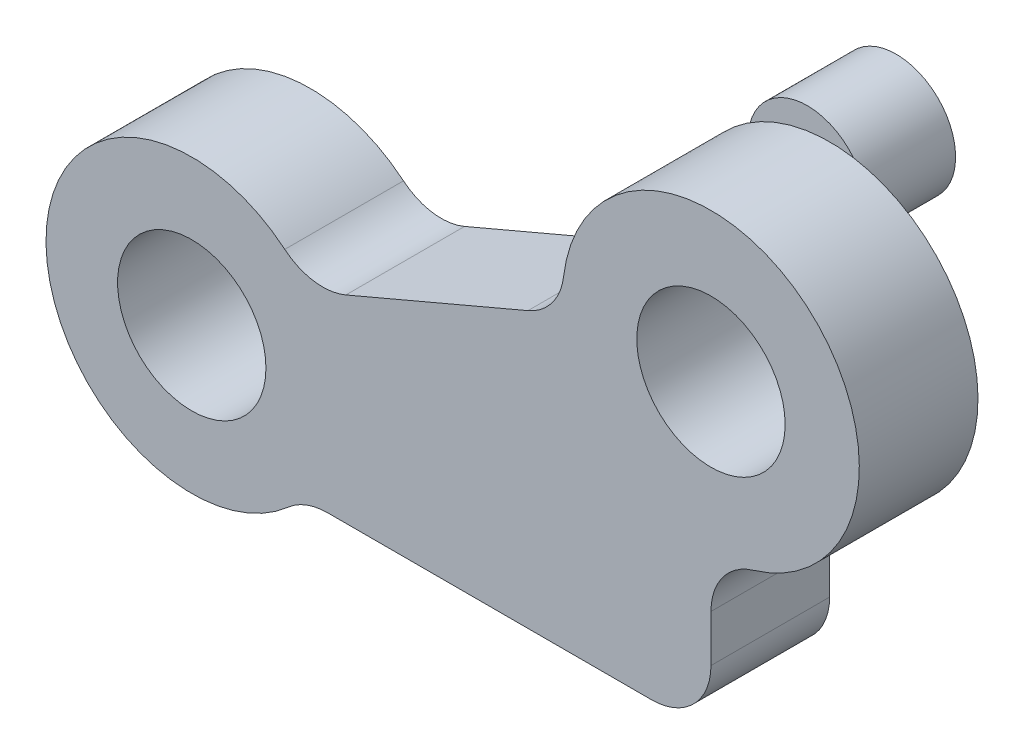
from build123d import *

# Parameters (mm, degrees)
SKETCH1_R           = 2.5
BOSS_EXTRUDE1_DEPTH = 4
FILLET1_R           = 2
BOSS_EXTRUDE2_START = -3.9
SKETCH2_R           = 1
BOSS_EXTRUDE2_DEPTH = 10
SKETCH3_R           = 2
BOSS_EXTRUDE3_DEPTH = 3


with BuildPart() as part:
    # Sketch1 → Boss-Extrude1 (new body)
    with BuildSketch(Plane.XY):
        with BuildLine():
            Line((56.839071038, 28.579919803), (56.839071038, 23.292312115))
            Line((56.839071038, 23.292312115), (43.08257304, 23.292312115))
            ThreePointArc((43.08257304, 23.292312115), (34.429928081, 26.628647856), (43.273147001, 29.420937259))
            Line((43.273147001, 29.420937259), (51.8645252, 33.076041142))
            ThreePointArc((51.8645252, 33.076041142), (60.191727201, 37.289326312), (56.839071038, 28.579919803))
        make_face()
        with Locations((39.340592987, 26.475947236)):
            Circle(SKETCH1_R, mode=Mode.SUBTRACT)
        with Locations((56.839071038, 33.579919803)):
            Circle(SKETCH1_R, mode=Mode.SUBTRACT)
    extrude(amount=BOSS_EXTRUDE1_DEPTH)

    # Fillet1
    fillet1_edges = [part.edges().sort_by_distance(p)[0] for p in [
        (43.08257304, 23.292312115, 2),
        (56.839071038, 23.292312115, 2),
        (56.839071038, 28.579919803, 2),
        (43.273147001, 29.420937259, 2),
        (51.8645252, 33.076041142, 2),
    ]]
    fillet(fillet1_edges, radius=FILLET1_R)

    # Sketch2 → Boss-Extrude2 (add)
    with BuildSketch(Plane.XY.offset(4).offset(BOSS_EXTRUDE2_START)):
        with Locations((46.18381054, 27.359606691)):
            Circle(SKETCH2_R)
    extrude(amount=-BOSS_EXTRUDE2_DEPTH)

    # Sketch3 → Boss-Extrude3 (add)
    with BuildSketch(Plane(origin=(0, 0, -9.9), x_dir=(-1, 0, 0), z_dir=(0, 0, -1))):
        with Locations((-46.18381054, 27.359606691)):
            Circle(SKETCH3_R)
    extrude(amount=BOSS_EXTRUDE3_DEPTH)


solid = part.part
